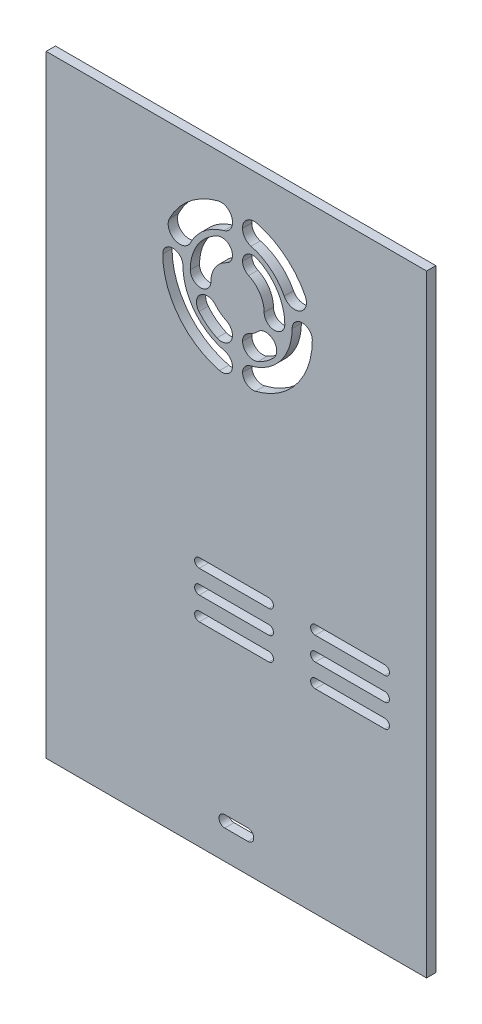
from build123d import *

# Parameters (mm, degrees)
SKETCH1_W            = 164
SKETCH1_H            = 264
BOSS_EXTRUDE1_DEPTH  = 4
CUT_EXTRUDE3_DEPTH   = 10
CUT_EXTRUDE4_DEPTH   = 10
LPATTERN1_COUNT      = 3
LPATTERN1_PITCH      = 10
LPATTERN1_COUNT_DIR2 = 2
LPATTERN1_PITCH_DIR2 = 50
CUT_EXTRUDE5_DEPTH   = 10
SKETCH5_W            = 4.319122357
SKETCH5_H            = 26.937684175
SKETCH5_H_2          = 25.730682063
BOSS_EXTRUDE2_DEPTH  = 4
FILLET3_R            = 5
FILLET4_R            = 5
FILLET5_R            = 4.5
FILLET6_R            = 4.5
FILLET7_R            = 4.75
FILLET8_R            = 4.75
FILLET9_R            = 4.5
FILLET10_R           = 4.5


with BuildPart() as part:
    # Sketch1 → Boss-Extrude1 (new body)
    with BuildSketch(Plane.XY):
        with Locations((12.541176471, -29.098039216)):
            Rectangle(SKETCH1_W, SKETCH1_H)
    extrude(amount=BOSS_EXTRUDE1_DEPTH)

    # Sketch2 → Cut-Extrude3 (cut)
    with BuildSketch(Plane.XY.offset(4)):
        with BuildLine():
            ThreePointArc((-19.196819428, 52.401960784), (13.041176471, 20.163964886), (45.279172369, 52.401960784))
            ThreePointArc((45.279172369, 52.401960784), (40.932647519, 56.748485634), (36.58612267, 52.401960784))
            ThreePointArc((36.58612267, 52.401960784), (13.041176471, 28.857014585), (-10.503769729, 52.401960784))
            ThreePointArc((-10.503769729, 52.401960784), (-14.850294578, 56.748485634), (-19.196819428, 52.401960784))
        make_face()
        with BuildLine():
            ThreePointArc((33.426584493, 52.401960784), (13.041176471, 72.787368807), (-7.344231552, 52.401960784))
            ThreePointArc((-7.344231552, 52.401960784), (-2.891363068, 47.949092301), (1.561505415, 52.401960784))
            ThreePointArc((1.561505415, 52.401960784), (13.041176471, 63.88163184), (24.520847526, 52.401960784))
            ThreePointArc((24.520847526, 52.401960784), (28.97371601, 47.949092301), (33.426584493, 52.401960784))
        make_face()
        with BuildLine():
            ThreePointArc((42.181568033, 67.499048907), (12.784631297, 85.219923468), (-16.331673874, 67.04163813))
            ThreePointArc((-16.331673874, 67.04163813), (-14.055015917, 60.240559274), (-7.253937061, 62.517217231))
            ThreePointArc((-7.253937061, 62.517217231), (12.863917084, 75.077467953), (33.17567306, 62.833264313))
            ThreePointArc((33.17567306, 62.833264313), (40.011512844, 60.663209124), (42.181568033, 67.499048907))
        make_face()
        with BuildLine():
            ThreePointArc((-3.609454357, 38.710399181), (12.244809645, 30.859719351), (28.635450382, 37.518379654))
            ThreePointArc((28.635450382, 37.518379654), (28.481389363, 44.125242049), (21.874526968, 43.97118103))
            ThreePointArc((21.874526968, 43.97118103), (12.590075808, 40.199393986), (3.609454357, 44.646398506))
            ThreePointArc((3.609454357, 44.646398506), (-2.967999663, 45.2878532), (-3.609454357, 38.710399181))
        make_face()
    extrude(amount=-CUT_EXTRUDE3_DEPTH, mode=Mode.SUBTRACT)

    # Sketch3 → Cut-Extrude4 (cut)
    with BuildSketch(Plane.XY.offset(4)):
        with BuildLine():
            Line((76.541176471, -57.098039216), (46.541176471, -57.098039216))
            ThreePointArc((46.541176471, -57.098039216), (44.541176471, -55.098039216), (46.541176471, -53.098039216))
            Line((46.541176471, -53.098039216), (76.541176471, -53.098039216))
            ThreePointArc((76.541176471, -53.098039216), (78.541176471, -55.098039216), (76.541176471, -57.098039216))
        make_face()
    cut_extrude4 = extrude(amount=-CUT_EXTRUDE4_DEPTH, mode=Mode.SUBTRACT)

    # LPattern1: Cut-Extrude4 3 × 2
    with Locations(*[(-j * LPATTERN1_PITCH_DIR2, -i * LPATTERN1_PITCH, 0) for i in range(LPATTERN1_COUNT) for j in range(LPATTERN1_COUNT_DIR2) if (i, j) != (0, 0)]):
        add(cut_extrude4, mode=Mode.SUBTRACT)

    # Sketch4 → Cut-Extrude5 (cut)
    with BuildSketch(Plane.XY.offset(4)):
        with BuildLine():
            Line((7.541176471, -143.598039216), (17.541176471, -143.598039216))
            ThreePointArc((17.541176471, -143.598039216), (20.041176471, -146.098039216), (17.541176471, -148.598039216))
            Line((17.541176471, -148.598039216), (7.541176471, -148.598039216))
            ThreePointArc((7.541176471, -148.598039216), (5.041176471, -146.098039216), (7.541176471, -143.598039216))
        make_face()
    extrude(amount=-CUT_EXTRUDE5_DEPTH, mode=Mode.SUBTRACT)

    # Sketch5 → Boss-Extrude2 (add)
    with BuildSketch(Plane.XY.offset(4)):
        with Locations((13.038358708, 73.546081582)):
            Rectangle(SKETCH5_W, SKETCH5_H)
        with Locations((13.038358708, 29.708086806)):
            Rectangle(SKETCH5_W, SKETCH5_H_2)
    extrude(amount=-BOSS_EXTRUDE2_DEPTH)

    # Fillet3
    fillet3_edges = [part.edges().sort_by_distance(p)[0] for p in [
        (15.197919886, 74.975363365, 2),
        (15.197919886, 85.149982831, 2),
    ]]
    fillet(fillet3_edges, radius=FILLET3_R)

    # Fillet4
    fillet4_edges = [part.edges().sort_by_distance(p)[0] for p in [
        (10.878797529, 74.974824217, 2),
        (10.878797529, 85.149611196, 2),
    ]]
    fillet(fillet4_edges, radius=FILLET4_R)

    # Fillet5
    # the kernel refuses this fillet: 4.5 mm, written as the material it adds along each edge
    with BuildSketch(Plane(origin=(10.878797529, 63.676133253, 0), x_dir=(-0.952400444463688, -0.3048497882324502, 0), z_dir=(0, 0, 1))) as fillet5_piece_1:
        with BuildLine():
            CenterArc((3.294924666, -4.467486403), FILLET5_R, 96.891689821, 65.359183141)
            Line((-0.990877334, -3.095662356), (0, 0))
            ThreePointArc((0, 0), (1.377478425, -0.082943423), (2.75495685, 0))
        make_face()
    extrude(amount=4)
    with BuildSketch(Plane(origin=(10.878797529, 72.672357366, 0), x_dir=(0, -1, 0), z_dir=(0, 0, 1))) as fillet5_piece_2:
        with BuildLine():
            CenterArc((5.849616613, -4.5), FILLET5_R, 90, 114.796867003)
            ThreePointArc((1.764514753, -6.387310996), (0.620984955, -3.265832826), (0, 0))
            Line((0, 0), (5.849616613, 0))
        make_face()
    extrude(amount=4)

    # Fillet6
    # the kernel refuses this fillet: 4.5 mm, written as the material it adds along each edge
    with BuildSketch(Plane(origin=(15.197919886, 72.672957753, 0), x_dir=(0.963984906204346, -0.2659569525509686, 0), z_dir=(0, 0, 1))) as fillet6_piece_1:
        with BuildLine():
            CenterArc((5.893145872, -4.440206052), FILLET6_R, 80.649344531, 114.774478291)
            Line((1.555213794, -5.637012339), (0, 0))
            ThreePointArc((0, 0), (3.312144479, 0.270872005), (6.624288959, 0))
        make_face()
    extrude(amount=4)
    with BuildSketch(Plane(origin=(15.197919886, 63.677212683, 0), x_dir=(0.9525356739175572, -0.30442698617965064, 0), z_dir=(0, 0, 1))) as fillet6_piece_2:
        with BuildLine():
            CenterArc((3.296449531, 4.467456192), FILLET6_R, 197.723693353, 65.381411924)
            Line((-0.989961002, 3.097534754), (0, 0))
            ThreePointArc((0, 0), (1.378115911, 0.083020491), (2.756231822, 0))
        make_face()
    extrude(amount=4)

    # Fillet7
    # the kernel refuses this fillet: 4.75 mm, written as the material it adds along each edge
    with BuildSketch(Plane(origin=(15.197919886, 30.953165389, 0), x_dir=(0, 1, 0), z_dir=(0, 0, 1))) as fillet7_piece_1:
        with BuildLine():
            CenterArc((6.126567217, -4.75), FILLET7_R, 90, 114.26424477)
            ThreePointArc((1.796182676, -6.701991222), (0.626677135, -3.423736603), (0, 0))
            Line((0, 0), (6.126567217, 0))
        make_face()
    extrude(amount=4)
    with BuildSketch(Plane(origin=(15.197919886, 40.383034621, 0), x_dir=(0.9557846908185708, 0.2940673813887714, 0), z_dir=(0, 0, 1))) as fillet7_piece_2:
        with BuildLine():
            CenterArc((3.51897249, -4.715313748), FILLET7_R, 96.928419065, 65.969959025)
            Line((-1.021004791, -3.318493687), (0, 0))
            ThreePointArc((0, 0), (1.472991805, -0.08916851), (2.94598361, 0))
        make_face()
    extrude(amount=4)

    # Fillet8
    # the kernel refuses this fillet: 4.75 mm, written as the material it adds along each edge
    with BuildSketch(Plane(origin=(10.878797529, 40.384047255, 0), x_dir=(0, -1, 0), z_dir=(0, 0, 1))) as fillet8_piece_1:
        with BuildLine():
            CenterArc((3.470508434, -4.75), FILLET8_R, 90, 65.949113414)
            ThreePointArc((-0.867114896, -2.814147772), (-0.348416422, -1.433308135), (0, 0))
            Line((0, 0), (3.470508434, 0))
        make_face()
    extrude(amount=4)
    with BuildSketch(Plane(origin=(10.878797529, 30.953732806, 0), x_dir=(-0.9658301221176608, 0.2591759541511984, 0), z_dir=(0, 0, 1))) as fillet8_piece_2:
        with BuildLine():
            CenterArc((6.176063632, -4.688044059), FILLET8_R, 80.735851864, 114.285319943)
            Line((1.588370552, -5.919129841), (0, 0))
            ThreePointArc((0, 0), (3.470374234, 0.281175054), (6.940748468, 0))
        make_face()
    extrude(amount=4)

    # Fillet9
    # the kernel refuses this fillet: 4.5 mm, written as the material it adds along each edge
    with BuildSketch(Plane(origin=(10.878797529, 20.23656794, 0), x_dir=(0, 1, 0), z_dir=(0, 0, 1))) as fillet9_piece_1:
        with BuildLine():
            CenterArc((5.239399394, 4.5), FILLET9_R, 166.10226732, 103.89773268)
            ThreePointArc((0.871132452, 5.58085333), (0.313102845, 2.809542348), (0, 0))
            Line((0, 0), (5.239399394, 0))
        make_face()
    extrude(amount=4)
    with BuildSketch(Plane(origin=(10.878797529, 28.956521807, 0), x_dir=(-0.9862681446857605, 0.16515189002281502, 0), z_dir=(0, 0, 1))) as fillet9_piece_2:
        with BuildLine():
            CenterArc((3.811181811, 4.487703929), FILLET9_R, 189.50605818, 76.257380527)
            Line((-0.62702484, 3.744520424), (0, 0))
            ThreePointArc((0, 0), (1.739373093, 0.064335629), (3.478746186, 0))
        make_face()
    extrude(amount=4)

    # Fillet10
    # the kernel refuses this fillet: 4.5 mm, written as the material it adds along each edge
    with BuildSketch(Plane(origin=(15.197919886, 20.236189577, 0), x_dir=(0.9880653050237032, 0.15403555761062557, 0), z_dir=(0, 0, 1))) as fillet10_piece_1:
        with BuildLine():
            CenterArc((5.253191268, 4.482705444), FILLET10_R, 171.139133949, 103.885741164)
            Line((0.806897395, 5.175865453), (0, 0))
            ThreePointArc((0, 0), (2.823669163, -0.123898184), (5.647338326, 0))
        make_face()
    extrude(amount=4)
    with BuildSketch(Plane(origin=(15.197919886, 28.956002724, 0), x_dir=(0.9863050503076972, 0.16493134249599425, 0), z_dir=(0, 0, 1))) as fillet10_piece_2:
        with BuildLine():
            CenterArc((3.812043631, -4.48769836), FILLET10_R, 94.237521054, 76.269232907)
            Line((-0.626329096, -3.745507319), (0, 0))
            ThreePointArc((0, 0), (1.739766416, -0.064364768), (3.479532832, 0))
        make_face()
    extrude(amount=4)


solid = part.part
